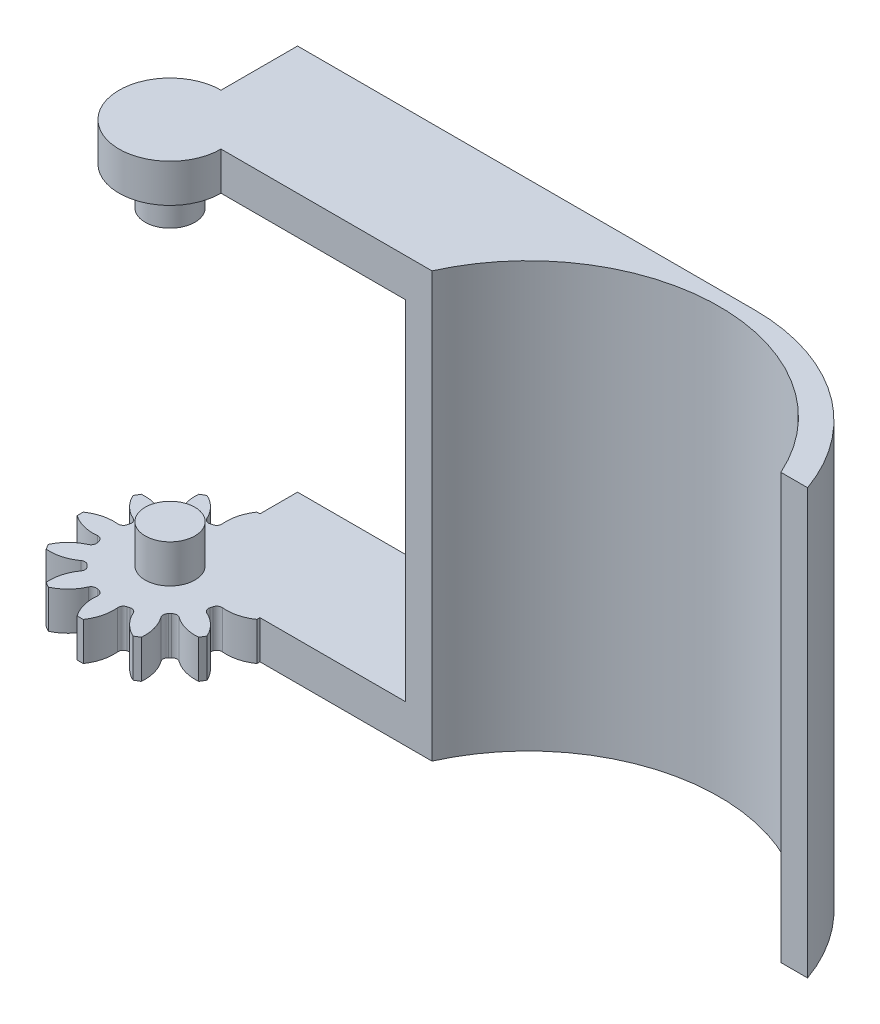
from build123d import *

# Parameters (mm, degrees)
SKETCH1_W           = 50
SKETCH1_H           = 10
BOSS_EXTRUDE2_DEPTH = 16.65
CUT_EXTRUDE1_START  = -27.3
SKETCH2_R           = 18.45
CUT_EXTRUDE1_DEPTH  = 27.3
SKETCH3_R           = 4
BOSS_EXTRUDE3_DEPTH = 3
BOSS_EXTRUDE4_START = 3
SKETCH5_R           = 4
BOSS_EXTRUDE4_DEPTH = 3
SKETCH4_R           = 1.95
BOSS_EXTRUDE6_DEPTH = 3
BOSS_EXTRUDE5_START = 3
SKETCH6_R           = 1.95
BOSS_EXTRUDE5_DEPTH = 3
BOSS_EXTRUDE7_DEPTH = 3
SKETCH8_R           = 15
CUT_EXTRUDE2_DEPTH  = 61.900656811
FILLET1_R           = 15


with BuildPart() as part:
    # Sketch1 → Boss-Extrude2 (new, symmetric)
    with BuildSketch(Plane(origin=(0, 0, 0), x_dir=(1, 0, 0), z_dir=(0, 1, 0))):
        with Locations((25, 5)):
            Rectangle(SKETCH1_W, SKETCH1_H)
    extrude(amount=BOSS_EXTRUDE2_DEPTH, both=True)

    # Sketch2 → Cut-Extrude1 (cut)
    with BuildSketch(Plane(origin=(0, 13.65, 0), x_dir=(1, 0, 0), z_dir=(0, 1, 0)).offset(CUT_EXTRUDE1_START)):
        Circle(SKETCH2_R)
    extrude(amount=CUT_EXTRUDE1_DEPTH, mode=Mode.SUBTRACT)

    # Sketch3 → Boss-Extrude3 (add)
    with BuildSketch(Plane(origin=(0, 13.65, 0), x_dir=(1, 0, 0), z_dir=(0, 1, 0))):
        Circle(SKETCH3_R)
    extrude(amount=BOSS_EXTRUDE3_DEPTH)

    # Sketch5 → Boss-Extrude4 (add)
    with BuildSketch(Plane(origin=(0, -13.65, 0), x_dir=(-1, 0, 0), z_dir=(0, -1, 0)).offset(BOSS_EXTRUDE4_START)):
        Circle(SKETCH5_R)
    extrude(amount=-BOSS_EXTRUDE4_DEPTH)

    # Sketch4 → Boss-Extrude6 (add)
    with BuildSketch(Plane.XZ.offset(-13.65)):
        with Locations(Location((0, 0, 0), (0, 0, 90))):
            Circle(SKETCH4_R)
    extrude(amount=BOSS_EXTRUDE6_DEPTH)

    # Sketch6 → Boss-Extrude5 (add)
    with BuildSketch(Plane(origin=(0, -13.65, 0), x_dir=(1, 0, 0), z_dir=(0, 1, 0)).offset(BOSS_EXTRUDE5_START)):
        with Locations(Location((0, 0, 0), (0, 0, 270))):
            Circle(SKETCH6_R)
    extrude(amount=-BOSS_EXTRUDE5_DEPTH)

    # Sketch7 → Boss-Extrude7 (add)
    with BuildSketch(Plane.XZ.offset(16.65)):
        with BuildLine():
            ThreePointArc((1.103045949, -4.464319525), (1.190197866, -4.441878907), (1.276893949, -4.417737093))
            ThreePointArc((1.276893949, -4.417737093), (1.56039667, -4.439315905), (1.760385559, -4.6414146))
            ThreePointArc((1.760385559, -4.6414146), (2.395683629, -5.570836958), (3.313490513, -6.222803277))
            ThreePointArc((3.313490513, -6.222803277), (3.525, -6.105479097), (3.732360464, -5.980968598))
            ThreePointArc((3.732360464, -5.980968598), (3.626644512, -4.860141361), (3.139390174, -3.845245915))
            ThreePointArc((3.139390174, -3.845245915), (3.064362014, -3.571001109), (3.187425576, -3.314691145))
            ThreePointArc((3.187425576, -3.314691145), (3.251681041, -3.251681041), (3.314691145, -3.187425576))
            ThreePointArc((3.314691145, -3.187425576), (3.571001109, -3.064362014), (3.845245915, -3.139390174))
            ThreePointArc((3.845245915, -3.139390174), (4.860141361, -3.626644512), (5.980968598, -3.732360464))
            ThreePointArc((5.980968598, -3.732360464), (6.105479097, -3.525), (6.222803277, -3.313490513))
            ThreePointArc((6.222803277, -3.313490513), (5.570836958, -2.395683629), (4.6414146, -1.760385559))
            ThreePointArc((4.6414146, -1.760385559), (4.439315905, -1.56039667), (4.417737093, -1.276893949))
            ThreePointArc((4.417737093, -1.276893949), (4.441878907, -1.190197866), (4.464319525, -1.103045949))
            ThreePointArc((4.464319525, -1.103045949), (4.624758685, -0.868314796), (4.899775733, -0.796168685))
            ThreePointArc((4.899775733, -0.796168685), (6.022328141, -0.710695597), (7.045850977, -0.241834679))
            ThreePointArc((7.045850977, -0.241834679), (7.05, 0), (7.045850977, 0.241834679))
            ThreePointArc((7.045850977, 0.241834679), (6.022328141, 0.710695597), (4.899775733, 0.796168685))
            ThreePointArc((4.899775733, 0.796168685), (4.624758685, 0.868314796), (4.464319525, 1.103045949))
            ThreePointArc((4.464319525, 1.103045949), (4.441878907, 1.190197866), (4.417737093, 1.276893949))
            ThreePointArc((4.417737093, 1.276893949), (4.439315905, 1.56039667), (4.6414146, 1.760385559))
            ThreePointArc((4.6414146, 1.760385559), (5.570836958, 2.395683629), (6.222803277, 3.313490513))
            ThreePointArc((6.222803277, 3.313490513), (6.105479097, 3.525), (5.980968598, 3.732360464))
            ThreePointArc((5.980968598, 3.732360464), (4.860141361, 3.626644512), (3.845245915, 3.139390174))
            ThreePointArc((3.845245915, 3.139390174), (3.571001109, 3.064362014), (3.314691145, 3.187425576))
            ThreePointArc((3.314691145, 3.187425576), (3.251681041, 3.251681041), (3.187425576, 3.314691145))
            ThreePointArc((3.187425576, 3.314691145), (3.064362014, 3.571001109), (3.139390174, 3.845245915))
            ThreePointArc((3.139390174, 3.845245915), (3.626644512, 4.860141361), (3.732360464, 5.980968598))
            ThreePointArc((3.732360464, 5.980968598), (3.525, 6.105479097), (3.313490513, 6.222803277))
            ThreePointArc((3.313490513, 6.222803277), (2.395683629, 5.570836958), (1.760385559, 4.6414146))
            ThreePointArc((1.760385559, 4.6414146), (1.56039667, 4.439315905), (1.276893949, 4.417737093))
            ThreePointArc((1.276893949, 4.417737093), (1.190197866, 4.441878907), (1.103045949, 4.464319525))
            ThreePointArc((1.103045949, 4.464319525), (0.868314796, 4.624758685), (0.796168685, 4.899775733))
            ThreePointArc((0.796168685, 4.899775733), (0.710695597, 6.022328141), (0.241834679, 7.045850977))
            ThreePointArc((0.241834679, 7.045850977), (0, 7.05), (-0.241834679, 7.045850977))
            ThreePointArc((-0.241834679, 7.045850977), (-0.710695597, 6.022328141), (-0.796168685, 4.899775733))
            ThreePointArc((-0.796168685, 4.899775733), (-0.868314796, 4.624758685), (-1.103045949, 4.464319525))
            ThreePointArc((-1.103045949, 4.464319525), (-1.190197866, 4.441878907), (-1.276893949, 4.417737093))
            ThreePointArc((-1.276893949, 4.417737093), (-1.56039667, 4.439315905), (-1.760385559, 4.6414146))
            ThreePointArc((-1.760385559, 4.6414146), (-2.395683629, 5.570836958), (-3.313490513, 6.222803277))
            ThreePointArc((-3.313490513, 6.222803277), (-3.525, 6.105479097), (-3.732360464, 5.980968598))
            ThreePointArc((-3.732360464, 5.980968598), (-3.626644512, 4.860141361), (-3.139390174, 3.845245915))
            ThreePointArc((-3.139390174, 3.845245915), (-3.064362014, 3.571001109), (-3.187425576, 3.314691145))
            ThreePointArc((-3.187425576, 3.314691145), (-3.251681041, 3.251681041), (-3.314691145, 3.187425576))
            ThreePointArc((-3.314691145, 3.187425576), (-3.571001109, 3.064362014), (-3.845245915, 3.139390174))
            ThreePointArc((-3.845245915, 3.139390174), (-4.860141361, 3.626644512), (-5.980968598, 3.732360464))
            ThreePointArc((-5.980968598, 3.732360464), (-6.105479097, 3.525), (-6.222803277, 3.313490513))
            ThreePointArc((-6.222803277, 3.313490513), (-5.570836958, 2.395683629), (-4.6414146, 1.760385559))
            ThreePointArc((-4.6414146, 1.760385559), (-4.439315905, 1.56039667), (-4.417737093, 1.276893949))
            ThreePointArc((-4.417737093, 1.276893949), (-4.441878907, 1.190197866), (-4.464319525, 1.103045949))
            ThreePointArc((-4.464319525, 1.103045949), (-4.624758685, 0.868314796), (-4.899775733, 0.796168685))
            ThreePointArc((-4.899775733, 0.796168685), (-6.022328141, 0.710695597), (-7.045850977, 0.241834679))
            ThreePointArc((-7.045850977, 0.241834679), (-7.05, 0), (-7.045850977, -0.241834679))
            ThreePointArc((-7.045850977, -0.241834679), (-6.022328141, -0.710695597), (-4.899775733, -0.796168685))
            ThreePointArc((-4.899775733, -0.796168685), (-4.624758685, -0.868314796), (-4.464319525, -1.103045949))
            ThreePointArc((-4.464319525, -1.103045949), (-4.441878907, -1.190197866), (-4.417737093, -1.276893949))
            ThreePointArc((-4.417737093, -1.276893949), (-4.439315905, -1.56039667), (-4.6414146, -1.760385559))
            ThreePointArc((-4.6414146, -1.760385559), (-5.570836958, -2.395683629), (-6.222803277, -3.313490513))
            ThreePointArc((-6.222803277, -3.313490513), (-6.105479097, -3.525), (-5.980968598, -3.732360464))
            ThreePointArc((-5.980968598, -3.732360464), (-4.860141361, -3.626644512), (-3.845245915, -3.139390174))
            ThreePointArc((-3.845245915, -3.139390174), (-3.571001109, -3.064362014), (-3.314691145, -3.187425576))
            ThreePointArc((-3.314691145, -3.187425576), (-3.251681041, -3.251681041), (-3.187425576, -3.314691145))
            ThreePointArc((-3.187425576, -3.314691145), (-3.064362014, -3.571001109), (-3.139390174, -3.845245915))
            ThreePointArc((-3.139390174, -3.845245915), (-3.626644512, -4.860141361), (-3.732360464, -5.980968598))
            ThreePointArc((-3.732360464, -5.980968598), (-3.525, -6.105479097), (-3.313490513, -6.222803277))
            ThreePointArc((-3.313490513, -6.222803277), (-2.395683629, -5.570836958), (-1.760385559, -4.6414146))
            ThreePointArc((-1.760385559, -4.6414146), (-1.56039667, -4.439315905), (-1.276893949, -4.417737093))
            ThreePointArc((-1.276893949, -4.417737093), (-1.190197866, -4.441878907), (-1.103045949, -4.464319525))
            ThreePointArc((-1.103045949, -4.464319525), (-0.868314796, -4.624758685), (-0.796168685, -4.899775733))
            ThreePointArc((-0.796168685, -4.899775733), (-0.710695597, -6.022328141), (-0.241834679, -7.045850977))
            ThreePointArc((-0.241834679, -7.045850977), (0, -7.05), (0.241834679, -7.045850977))
            ThreePointArc((0.241834679, -7.045850977), (0.710695597, -6.022328141), (0.796168685, -4.899775733))
            ThreePointArc((0.796168685, -4.899775733), (0.868314796, -4.624758685), (1.103045949, -4.464319525))
        make_face()
    extrude(amount=-BOSS_EXTRUDE7_DEPTH)

    # Sketch8 → Cut-Extrude2 (cut, through all)
    with BuildSketch(Plane.XZ.offset(16.65)):
        with Locations((34.225, 6.15)):
            Circle(SKETCH8_R)
    extrude(amount=-CUT_EXTRUDE2_DEPTH, mode=Mode.SUBTRACT)

    # Fillet1
    # the kernel refuses this fillet: 15 mm, written as the material it takes off along each edge
    with BuildSketch(Plane(origin=(50, -52.005339059, -10), x_dir=(-1, 0, 0), z_dir=(0, 1, 0))) as fillet1_piece_1:
        with BuildLine():
            CenterArc((14.142135624, 15), FILLET1_R, 199.471220634, 70.528779366)
            Line((0, 10), (-0.282842712, 9.9))
            ThreePointArc((-0.282842712, 9.9), (-0.3, 5), (-0.3, 0))
            Line((-0.3, 0), (0, -0.3))
            Line((0, -0.3), (14.142135624, -0.3))
            Line((14.142135624, -0.3), (14.142135624, 0))
        make_face()
    extrude(amount=104.010678119, mode=Mode.SUBTRACT)


solid = part.part
